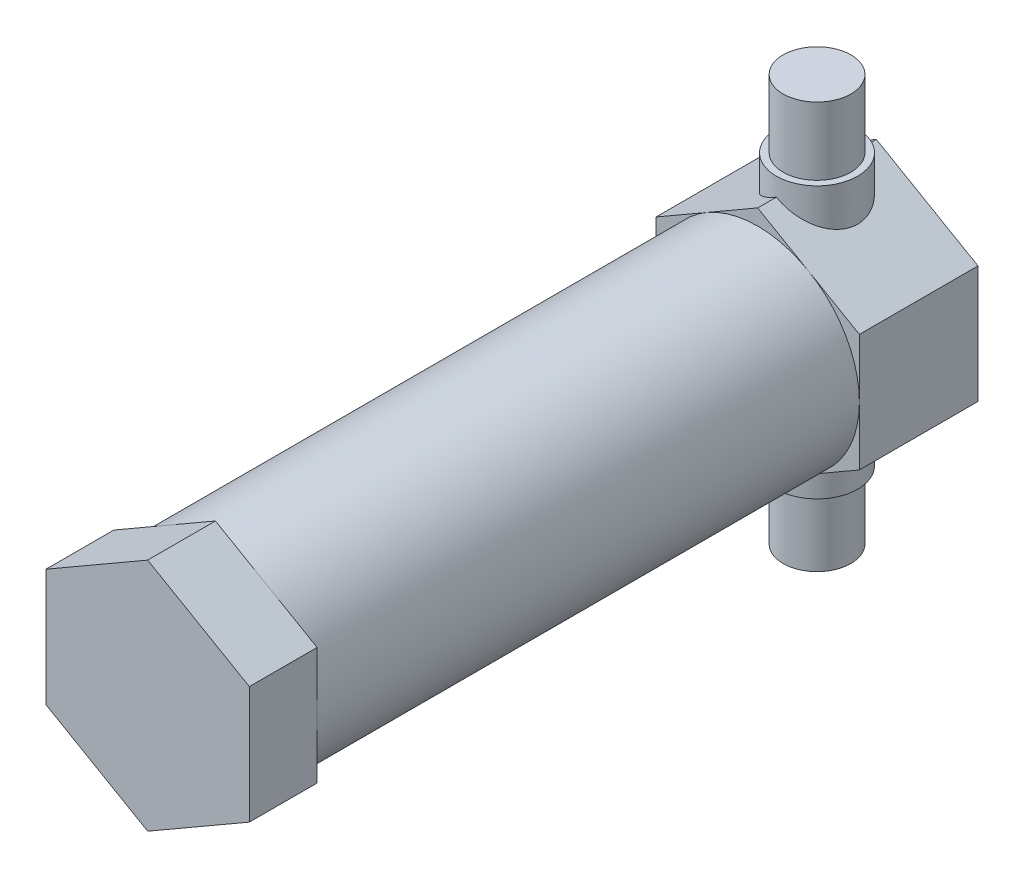
from build123d import *

# Parameters (mm, degrees)
SKETCH6_R           = 9.525
BOSS_EXTRUDE5_DEPTH = 68.2625
BOSS_EXTRUDE6_DEPTH = 6.35
BOSS_EXTRUDE7_DEPTH = 11.1125
SKETCH9_R           = 3.175
BOSS_EXTRUDE8_DEPTH = 19.05
SKETCH11_R          = 3.81
BOSS_EXTRUDE9_DEPTH = 12.7
SKETCH12_R          = 6.35
CUT_EXTRUDE2_DEPTH  = 50.8


with BuildPart() as part:
    # Sketch6 → Boss-Extrude5 (new body)
    with BuildSketch(Plane.XY):
        Circle(SKETCH6_R)
    extrude(amount=BOSS_EXTRUDE5_DEPTH)

    # Sketch7 → Boss-Extrude6 (add)
    with BuildSketch(Plane.XY.offset(68.2625)):
        Polygon((0, 10.998522628), (-9.525, 5.499261314), (-9.525, -5.499261314), (0, -10.998522628), (9.525, -5.499261314), (9.525, 5.499261314), align=None)
    extrude(amount=-BOSS_EXTRUDE6_DEPTH)

    # Sketch8 → Boss-Extrude7 (add)
    with BuildSketch(Plane(origin=(0, 0, 0), x_dir=(-1, 0, 0), z_dir=(0, 0, -1))):
        Polygon((0, 10.998522628), (-9.525, 5.499261314), (-9.525, -5.499261314), (0, -10.998522628), (9.525, -5.499261314), (9.525, 5.499261314), align=None)
    extrude(amount=-BOSS_EXTRUDE7_DEPTH)

    # Sketch9 → Boss-Extrude8 (add, symmetric)
    with BuildSketch(Plane(origin=(0, 0, 0), x_dir=(1, 0, 0), z_dir=(0, 1, 0))):
        with Locations((0, -5.55625)):
            Circle(SKETCH9_R)
    extrude(amount=BOSS_EXTRUDE8_DEPTH, both=True)

    # Sketch11 → Boss-Extrude9 (add, symmetric)
    with BuildSketch(Plane(origin=(0, 0, 0), x_dir=(1, 0, 0), z_dir=(0, 1, 0))):
        with Locations((0, -5.55625)):
            Circle(SKETCH11_R)
    extrude(amount=BOSS_EXTRUDE9_DEPTH, both=True)

    # Sketch12 → Cut-Extrude2 (cut)
    with BuildSketch(Plane(origin=(0, 0, 0), x_dir=(-1, 0, 0), z_dir=(0, 0, -1))):
        Circle(SKETCH12_R)
    extrude(amount=-CUT_EXTRUDE2_DEPTH, mode=Mode.SUBTRACT)


solid = part.part
